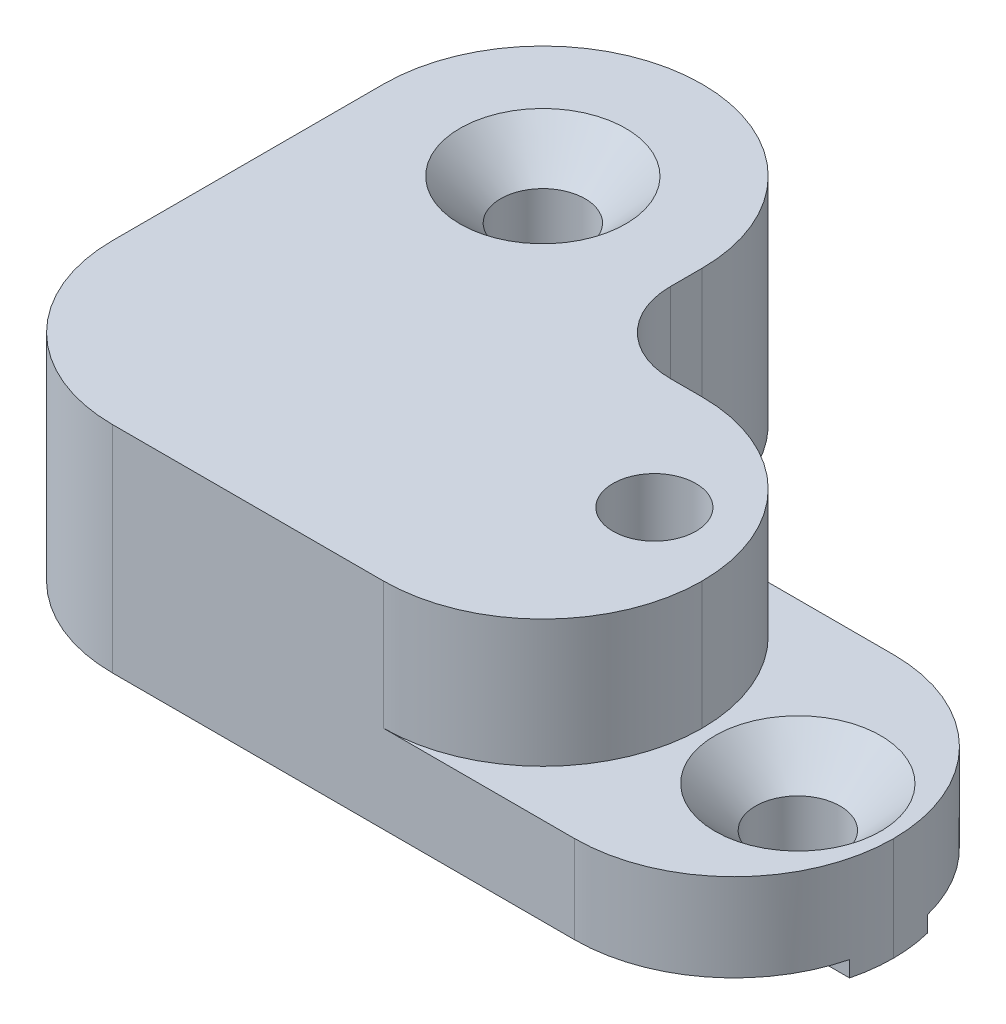
from build123d import *

# Parameters (mm, degrees)
BOSS_EXTRUDE1_DEPTH                             = 13.5
BOSS_EXTRUDE2_START                             = -13.5
SKETCH1_3_W                                     = 16.5
SKETCH1_3_H                                     = 4.9
BOSS_EXTRUDE2_DEPTH                             = 1
BOSS_EXTRUDE3_DEPTH                             = 0.6
CSK_FOR_M5_FLAT_HEAD_MACHINE_SCREW1_D           = 5.3
CSK_FOR_M5_FLAT_HEAD_MACHINE_SCREW1_CSINK_D     = 10.4
CSK_FOR_M5_FLAT_HEAD_MACHINE_SCREW1_CSINK_ANGLE = 90
BOSS_EXTRUDE4_START                             = -8
SKETCH1_5_W                                     = 12
SKETCH1_5_H                                     = 7.55
SKETCH1_5_H_2                                   = 4.9
BOSS_EXTRUDE4_DEPTH                             = 5.5
BOSS_EXTRUDE5_START                             = -13.5
SKETCH1_6_W                                     = 12
SKETCH1_6_H                                     = 4.9
BOSS_EXTRUDE5_DEPTH                             = 1
CSK_FOR_M5_FLAT_HEAD_MACHINE_SCREW2_D           = 5.3
CSK_FOR_M5_FLAT_HEAD_MACHINE_SCREW2_CSINK_D     = 10.4
CSK_FOR_M5_FLAT_HEAD_MACHINE_SCREW2_CSINK_ANGLE = 90
FILLET1_R                                       = 10
FILLET2_R                                       = 5
CUT_EXTRUDE1_DEPTH                              = 8
CHAMFER1_SIZE                                   = 1


with BuildPart() as part:
    # Sketch1 → Boss-Extrude1 (new body)
    with BuildSketch(Plane(origin=(0, 0, 0), x_dir=(1, 0, 0), z_dir=(0, 1, 0))):
        with BuildLine():
            Line((-1.919417382, -1.919417382), (-10, -10))
            Line((-10, -10), (27, -10))
            Line((27, -10), (27, -2.45))
            Line((27, -2.45), (10.5, -2.45))
            Line((10.5, -2.45), (10.5, 2.45))
            Line((10.5, 2.45), (18.900480814, 2.45))
            ThreePointArc((18.900480814, 2.45), (21.474998844, 5.099879794), (24.1, 2.5))
            ThreePointArc((24.1, 2.5), (24.099879794, 2.474998844), (24.099519186, 2.45))
            Line((24.099519186, 2.45), (27, 2.45))
            Line((27, 2.45), (27, 10))
            Line((27, 10), (10, 10))
            Line((10, 10), (6.919417382, 6.919417382))
            ThreePointArc((6.919417382, 6.919417382), (8.274247078, 4.891771452), (8.75, 2.5))
            ThreePointArc((8.75, 2.5), (4.891771452, -3.274247078), (-1.919417382, -1.919417382))
        make_face()
        with BuildLine():
            Line((10.5, -2.45), (27, -2.45))
            Line((27, -2.45), (27, 2.45))
            Line((27, 2.45), (24.099519186, 2.45))
            ThreePointArc((24.099519186, 2.45), (21.5, -0.1), (18.900480814, 2.45))
            Line((18.900480814, 2.45), (10.5, 2.45))
            Line((10.5, 2.45), (10.5, -2.45))
        make_face()
        with BuildLine():
            ThreePointArc((18.900480814, 2.45), (21.5, -0.1), (24.099519186, 2.45))
            Line((24.099519186, 2.45), (18.900480814, 2.45))
        make_face()
        with BuildLine():
            Line((18.900480814, 2.45), (24.099519186, 2.45))
            ThreePointArc((24.099519186, 2.45), (24.099879794, 2.474998844), (24.1, 2.5))
            ThreePointArc((24.1, 2.5), (21.474998844, 5.099879794), (18.900480814, 2.45))
        make_face()
    extrude(amount=-BOSS_EXTRUDE1_DEPTH)

    # Sketch1<3> → Boss-Extrude2 (add)
    with BuildSketch(Plane(origin=(0, 0, 0), x_dir=(1, 0, 0), z_dir=(0, 1, 0)).offset(BOSS_EXTRUDE2_START)):
        with Locations((18.75, 0)):
            Rectangle(SKETCH1_3_W, SKETCH1_3_H)
    extrude(amount=-BOSS_EXTRUDE2_DEPTH)

    # Sketch1<4> → Boss-Extrude3 (add)
    with BuildSketch(Plane(origin=(0, 0, 0), x_dir=(1, 0, 0), z_dir=(0, 1, 0))):
        with BuildLine():
            Line((6.919417382, 6.919417382), (-1.919417382, -1.919417382))
            ThreePointArc((-1.919417382, -1.919417382), (4.891771452, -3.274247078), (8.75, 2.5))
            ThreePointArc((8.75, 2.5), (8.274247078, 4.891771452), (6.919417382, 6.919417382))
        make_face()
    extrude(amount=-BOSS_EXTRUDE3_DEPTH)

    # Mirror1: part across plane


with BuildPart() as part_1:
    add(part.part)
    add(part.part.mirror(Plane(origin=(0, -13.5, 0), x_dir=(-0.7071067811865465, 0, 0.7071067811865486), z_dir=(0.7071067811865488, 0, 0.7071067811865464))))

    # CSK for M5 Flat Head Machine Screw1 (through all)
    with Locations(Plane(origin=(0, 0, 0), x_dir=(1, 0, 0), z_dir=(0, 1, 0))):
        with Locations((0, 17)):
            CounterSinkHole(CSK_FOR_M5_FLAT_HEAD_MACHINE_SCREW1_D / 2, CSK_FOR_M5_FLAT_HEAD_MACHINE_SCREW1_CSINK_D / 2, counter_sink_angle=CSK_FOR_M5_FLAT_HEAD_MACHINE_SCREW1_CSINK_ANGLE)

    # Sketch1<5> → Boss-Extrude4 (add)
    with BuildSketch(Plane(origin=(0, 0, 0), x_dir=(1, 0, 0), z_dir=(0, 1, 0)).offset(BOSS_EXTRUDE4_START)):
        with Locations((33, 6.225)):
            Rectangle(SKETCH1_5_W, SKETCH1_5_H)
        with Locations((33, 0)):
            Rectangle(SKETCH1_5_W, SKETCH1_5_H_2)
        with Locations((33, -6.225)):
            Rectangle(SKETCH1_5_W, SKETCH1_5_H)
    extrude(amount=-BOSS_EXTRUDE4_DEPTH)

    # Sketch1<6> → Boss-Extrude5 (add)
    with BuildSketch(Plane(origin=(0, 0, 0), x_dir=(1, 0, 0), z_dir=(0, 1, 0)).offset(BOSS_EXTRUDE5_START)):
        with Locations((33, 0)):
            Rectangle(SKETCH1_6_W, SKETCH1_6_H)
    extrude(amount=-BOSS_EXTRUDE5_DEPTH)

    # CSK for M5 Flat Head Machine Screw2 (through all)
    with Locations(Plane(origin=(0, -8, 0), x_dir=(1, 0, 0), z_dir=(0, 1, 0))):
        with Locations((33, 0)):
            CounterSinkHole(CSK_FOR_M5_FLAT_HEAD_MACHINE_SCREW2_D / 2, CSK_FOR_M5_FLAT_HEAD_MACHINE_SCREW2_CSINK_D / 2, counter_sink_angle=CSK_FOR_M5_FLAT_HEAD_MACHINE_SCREW2_CSINK_ANGLE)

    # Fillet1
    fillet1_edges = [part_1.edges().sort_by_distance(p)[0] for p in [
        (-10, -6.75, -27),
        (10, -6.75, -27),
        (39, -10.75, -10),
        (39, -10.75, 10),
        (27, -4, -10),
        (27, -4, 10),
        (-10, -6.75, 10),
    ]]
    fillet(fillet1_edges, radius=FILLET1_R - 0.0001)  # a hair under: the kernel refuses the full size

    # Fillet2
    fillet2_edges = [part_1.edges().sort_by_distance(p)[0] for p in [
        (10, -6.75, -10),
    ]]
    fillet(fillet2_edges, radius=FILLET2_R)

    # Sketch1<8> → Cut-Extrude1 (cut)
    with BuildSketch(Plane(origin=(0, 0, 0), x_dir=(1, 0, 0), z_dir=(0, 1, 0))):
        with BuildLine():
            ThreePointArc((18.900480814, 2.45), (21.5, -0.1), (24.099519186, 2.45))
            Line((24.099519186, 2.45), (18.900480814, 2.45))
        make_face()
        with BuildLine():
            Line((18.900480814, 2.45), (24.099519186, 2.45))
            ThreePointArc((24.099519186, 2.45), (24.099879794, 2.474998844), (24.1, 2.5))
            ThreePointArc((24.1, 2.5), (21.474998844, 5.099879794), (18.900480814, 2.45))
        make_face()
    extrude(amount=-CUT_EXTRUDE1_DEPTH, mode=Mode.SUBTRACT)

    # Chamfer1
    chamfer1_edges = [part_1.edges().sort_by_distance(p)[0] for p in [
        (24.099519186, -8, -2.55),
    ]]
    chamfer(chamfer1_edges, length=CHAMFER1_SIZE)


solid = part_1.part
